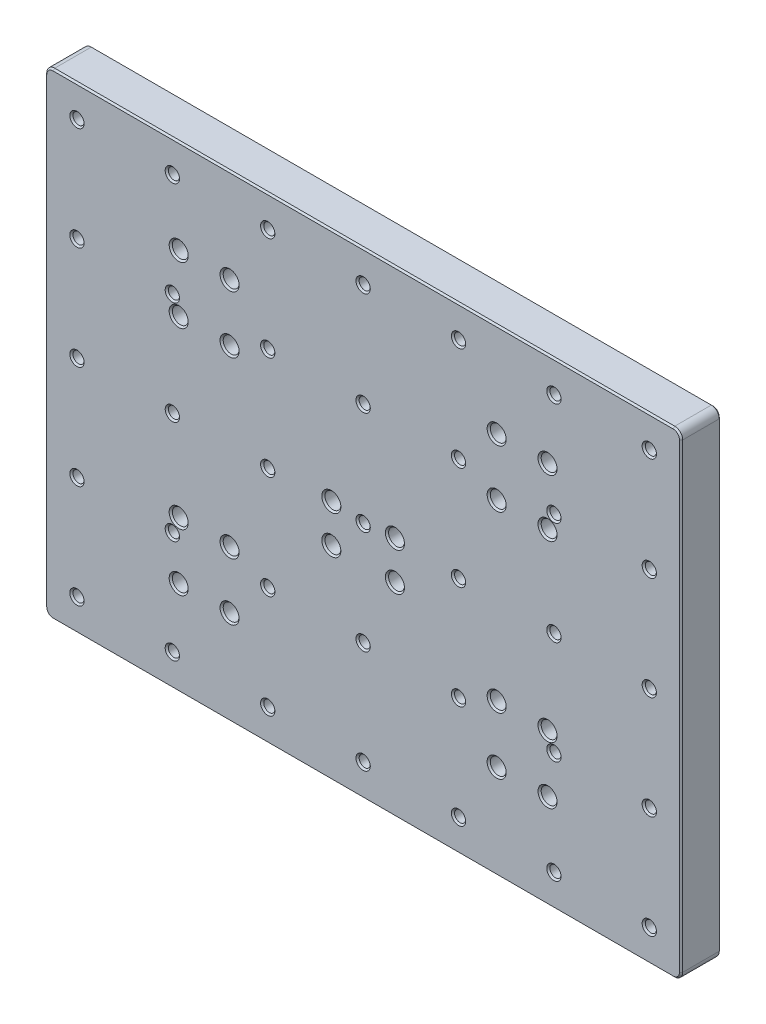
from build123d import *

# Parameters (mm, degrees)
SKETCH1_W                      = 400
SKETCH1_H                      = 300
BOSS_EXTRUDE1_DEPTH            = 25
CBORE_FOR_M5_SHCS1_D           = 5.5
CBORE_FOR_M5_SHCS1_DEPTH       = 28.347633298
CBORE_FOR_M5_SHCS1_CBORE_D     = 10
CBORE_FOR_M5_SHCS1_CBORE_DEPTH = 8
CBORE_FOR_M5_SHCS1_TIP         = 1.652366702
FILLET1_R                      = 5
SKETCH5_R                      = 3.5
CUT_EXTRUDE2_DEPTH             = 252.246890528
SKETCH6_R                      = 2.75
CUT_EXTRUDE3_DEPTH             = 252.246890528
SKETCH7_R                      = 5
CUT_EXTRUDE4_DEPTH             = 8
CHAMFER2_SIZE                  = 1
CHAMFER1_SIZE                  = 1


with BuildPart() as part:
    # Sketch1 → Boss-Extrude1 (new body)
    with BuildSketch(Plane.XY):
        Rectangle(SKETCH1_W, SKETCH1_H)
    extrude(amount=BOSS_EXTRUDE1_DEPTH)

    # CBORE for M5 SHCS1
    with Locations(Plane(origin=(-116, 90.75, 25), x_dir=(1, 0, 0), z_dir=(0, 0, 1))):
        with Locations((0, 0), (32, 0), (0, -36), (32, -36), (0, -145.5), (32, -145.5), (0, -181.5), (32, -181.5), (232, -181.5), (200, -181.5), (200, -145.5), (232, -145.5), (200, 0), (232, 0), (200, -36), (232, -36)):
            CounterBoreHole(CBORE_FOR_M5_SHCS1_D / 2, CBORE_FOR_M5_SHCS1_CBORE_D / 2, CBORE_FOR_M5_SHCS1_CBORE_DEPTH, depth=CBORE_FOR_M5_SHCS1_DEPTH)
            with Locations((0, 0, -(CBORE_FOR_M5_SHCS1_DEPTH + CBORE_FOR_M5_SHCS1_TIP / 2))):  # 118° drill point
                Cone(0, CBORE_FOR_M5_SHCS1_D / 2, CBORE_FOR_M5_SHCS1_TIP, mode=Mode.SUBTRACT)

    # Fillet1
    fillet1_edges = [part.edges().sort_by_distance(p)[0] for p in [
        (200, 150, 12.5),
        (200, -150, 12.5),
        (-200, -150, 12.5),
        (-200, 150, 12.5),
    ]]
    fillet(fillet1_edges, radius=FILLET1_R)

    # Sketch5 → Cut-Extrude2 (cut, through all)
    with BuildSketch(Plane.XY.offset(25)):
        with Locations((-180, 130)):
            Circle(SKETCH5_R)
        with Locations((-120, 130)):
            Circle(SKETCH5_R)
        with Locations((-60, 130)):
            Circle(SKETCH5_R)
        with Locations((0, 130)):
            Circle(SKETCH5_R)
        with Locations((60, 130)):
            Circle(SKETCH5_R)
        with Locations((120, 130)):
            Circle(SKETCH5_R)
        with Locations((180, 130)):
            Circle(SKETCH5_R)
        with Locations((-120, 65)):
            Circle(SKETCH5_R)
        with Locations((-60, 65)):
            Circle(SKETCH5_R)
        with Locations((0, 65)):
            Circle(SKETCH5_R)
        with Locations((60, 65)):
            Circle(SKETCH5_R)
        with Locations((120, 65)):
            Circle(SKETCH5_R)
        with Locations((180, 65)):
            Circle(SKETCH5_R)
        with Locations((-120, 0)):
            Circle(SKETCH5_R)
        with Locations((-60, 0)):
            Circle(SKETCH5_R)
        Circle(SKETCH5_R)
        with Locations((60, 0)):
            Circle(SKETCH5_R)
        with Locations((120, 0)):
            Circle(SKETCH5_R)
        with Locations((180, 0)):
            Circle(SKETCH5_R)
        with Locations((-120, -65)):
            Circle(SKETCH5_R)
        with Locations((-60, -65)):
            Circle(SKETCH5_R)
        with Locations((0, -65)):
            Circle(SKETCH5_R)
        with Locations((60, -65)):
            Circle(SKETCH5_R)
        with Locations((120, -65)):
            Circle(SKETCH5_R)
        with Locations((180, -65)):
            Circle(SKETCH5_R)
        with Locations((-120, -130)):
            Circle(SKETCH5_R)
        with Locations((-60, -130)):
            Circle(SKETCH5_R)
        with Locations((0, -130)):
            Circle(SKETCH5_R)
        with Locations((60, -130)):
            Circle(SKETCH5_R)
        with Locations((120, -130)):
            Circle(SKETCH5_R)
        with Locations((180, -130)):
            Circle(SKETCH5_R)
        with Locations((-180, 65)):
            Circle(SKETCH5_R)
        with Locations((-180, 0)):
            Circle(SKETCH5_R)
        with Locations((-180, -65)):
            Circle(SKETCH5_R)
        with Locations((-180, -130)):
            Circle(SKETCH5_R)
    extrude(amount=-CUT_EXTRUDE2_DEPTH, mode=Mode.SUBTRACT)

    # Sketch6 → Cut-Extrude3 (cut, through all)
    with BuildSketch(Plane(origin=(0, 0, 0), x_dir=(-1, 0, 0), z_dir=(0, 0, -1))):
        with Locations((20, -22)):
            Circle(SKETCH6_R)
        with Locations((20, 2)):
            Circle(SKETCH6_R)
        with Locations((-20, -22)):
            Circle(SKETCH6_R)
        with Locations((-20, 2)):
            Circle(SKETCH6_R)
    extrude(amount=-CUT_EXTRUDE3_DEPTH, mode=Mode.SUBTRACT)

    # Sketch7 → Cut-Extrude4 (cut)
    with BuildSketch(Plane(origin=(0, 0, 25), x_dir=(-1, 0, 0), z_dir=(0, 0, -1))):
        with Locations((-20, 2)):
            Circle(SKETCH7_R)
        with Locations((20, 2)):
            Circle(SKETCH7_R)
        with Locations((-20, -22)):
            Circle(SKETCH7_R)
        with Locations((20, -22)):
            Circle(SKETCH7_R)
    extrude(amount=CUT_EXTRUDE4_DEPTH, mode=Mode.SUBTRACT)

    # Chamfer2
    chamfer2_edges = [part.edges().sort_by_distance(p)[0] for p in [
        (-198.535533906, 148.535533906, 0),
        (-200, 0, 0),
        (-198.535533906, -148.535533906, 0),
        (0, -150, 0),
        (198.535533906, -148.535533906, 0),
        (200, 0, 0),
        (198.535533906, 148.535533906, 0),
        (0, 150, 0),
        (118.75, 54.75, 0),
        (86.75, 54.75, 0),
        (118.75, 90.75, 0),
        (86.75, 90.75, 0),
        (118.75, -54.75, 0),
        (86.75, -54.75, 0),
        (86.75, -90.75, 0),
        (118.75, -90.75, 0),
        (-81.25, -90.75, 0),
        (-113.25, -90.75, 0),
        (-81.25, -54.75, 0),
        (-113.25, -54.75, 0),
        (-81.25, 54.75, 0),
        (-113.25, 54.75, 0),
        (-81.25, 90.75, 0),
        (-113.25, 90.75, 0),
        (-183.5, 130, 0),
        (-183.5, -130, 0),
        (-183.5, -65, 0),
        (56.5, 0, 0),
        (-3.5, 0, 0),
        (-63.5, 0, 0),
        (-123.5, 0, 0),
        (176.5, 65, 0),
        (116.5, 65, 0),
        (56.5, 65, 0),
        (-3.5, 65, 0),
        (-123.5, 130, 0),
        (-63.5, 130, 0),
        (-3.5, 130, 0),
        (56.5, 130, 0),
        (116.5, 130, 0),
        (176.5, 130, 0),
        (-123.5, 65, 0),
        (-63.5, 65, 0),
        (-123.5, -130, 0),
        (-63.5, -130, 0),
        (-3.5, -130, 0),
        (56.5, -130, 0),
        (116.5, -130, 0),
        (176.5, -130, 0),
        (-183.5, 65, 0),
        (-183.5, 0, 0),
        (116.5, 0, 0),
        (176.5, 0, 0),
        (-123.5, -65, 0),
        (-63.5, -65, 0),
        (-3.5, -65, 0),
        (56.5, -65, 0),
        (116.5, -65, 0),
        (176.5, -65, 0),
        (-17.25, -22, 0),
        (22.75, 2, 0),
        (22.75, -22, 0),
        (-17.25, 2, 0),
    ]]
    chamfer(chamfer2_edges, length=CHAMFER2_SIZE)

    # Chamfer1
    chamfer1_edges = [part.edges().sort_by_distance(p)[0] for p in [
        (198.535533906, -148.535533906, 25),
        (0, -150, 25),
        (-198.535533906, -148.535533906, 25),
        (-200, 0, 25),
        (-198.535533906, 148.535533906, 25),
        (0, 150, 25),
        (198.535533906, 148.535533906, 25),
        (200, 0, 25),
        (111, 54.75, 25),
        (79, 54.75, 25),
        (111, 90.75, 25),
        (79, 90.75, 25),
        (111, -54.75, 25),
        (79, -54.75, 25),
        (79, -90.75, 25),
        (111, -90.75, 25),
        (-89, -90.75, 25),
        (-121, -90.75, 25),
        (-89, -54.75, 25),
        (-121, -54.75, 25),
        (-89, 54.75, 25),
        (-121, 54.75, 25),
        (-89, 90.75, 25),
        (-121, 90.75, 25),
        (-183.5, 130, 25),
        (-183.5, -130, 25),
        (-183.5, -65, 25),
        (56.5, 0, 25),
        (-3.5, 0, 25),
        (-63.5, 0, 25),
        (-123.5, 0, 25),
        (176.5, 65, 25),
        (116.5, 65, 25),
        (56.5, 65, 25),
        (-3.5, 65, 25),
        (-123.5, 130, 25),
        (-63.5, 130, 25),
        (-3.5, 130, 25),
        (56.5, 130, 25),
        (116.5, 130, 25),
        (176.5, 130, 25),
        (-123.5, 65, 25),
        (-63.5, 65, 25),
        (-123.5, -130, 25),
        (-63.5, -130, 25),
        (-3.5, -130, 25),
        (56.5, -130, 25),
        (116.5, -130, 25),
        (176.5, -130, 25),
        (-183.5, 65, 25),
        (-183.5, 0, 25),
        (116.5, 0, 25),
        (176.5, 0, 25),
        (-123.5, -65, 25),
        (-63.5, -65, 25),
        (-3.5, -65, 25),
        (56.5, -65, 25),
        (116.5, -65, 25),
        (176.5, -65, 25),
        (25, 2, 25),
        (-15, -22, 25),
        (25, -22, 25),
        (-15, 2, 25),
    ]]
    chamfer(chamfer1_edges, length=CHAMFER1_SIZE)


solid = part.part
